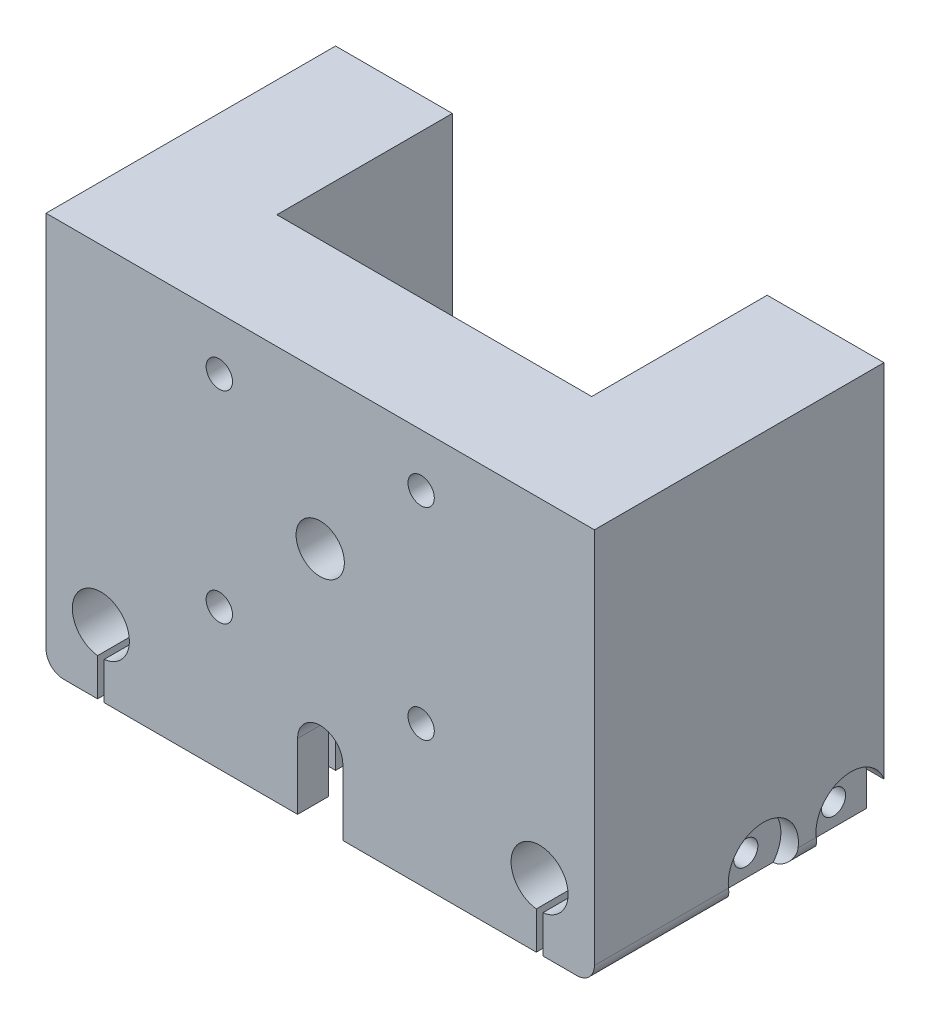
from build123d import *

# Parameters (mm, degrees)
SKETCH1_W           = 62.5
SKETCH1_H           = 45
BOSS_EXTRUDE1_DEPTH = 20
SKETCH2_W           = 37.5
SKETCH2_H           = 45
CUT_EXTRUDE1_DEPTH  = 5
SKETCH3_R           = 11.5
CUT_EXTRUDE2_DEPTH  = 2
SKETCH4_R           = 1.5
CUT_EXTRUDE3_DEPTH  = 15
CIRPATTERN1_COUNT   = 4
SKETCH5_R           = 2.75
CUT_EXTRUDE4_DEPTH  = 58.66769
CUT_EXTRUDE7_START  = -6.5
CUT_EXTRUDE7_DEPTH  = 3
CUT_EXTRUDE8_DEPTH  = 6.5
CUT_EXTRUDE9_DEPTH  = 5.5
SKETCH11_R          = 1.375
CUT_EXTRUDE10_DEPTH = 80.569152
FILLET1_R           = 2
SKETCH12_R          = 3.625
CUT_EXTRUDE12_DEPTH = 3
BOSS_EXTRUDE2_START = 20
BOSS_EXTRUDE2_DEPTH = 20
SKETCH14_R          = 4
CUT_EXTRUDE18_DEPTH = 2
SKETCH15_W          = 62.5
SKETCH15_H          = 45
CUT_EXTRUDE19_DEPTH = 7
SKETCH16_R          = 3.25
CUT_EXTRUDE20_DEPTH = 64.957506
SKETCH17_R          = 1.375
CUT_EXTRUDE21_DEPTH = 79.008013


with BuildPart() as part:
    # Sketch1 → Boss-Extrude1 (new body)
    with BuildSketch(Plane.XY):
        with Locations((0, 22.5)):
            Rectangle(SKETCH1_W, SKETCH1_H)
    extrude(amount=BOSS_EXTRUDE1_DEPTH)

    # Sketch2 → Cut-Extrude1 (cut)
    with BuildSketch(Plane.XY.offset(20)):
        with Locations((0, 22.5)):
            Rectangle(SKETCH2_W, SKETCH2_H)
    extrude(amount=-CUT_EXTRUDE1_DEPTH, mode=Mode.SUBTRACT)

    # Sketch3 → Cut-Extrude2 (cut)
    with BuildSketch(Plane(origin=(0, 0, 0), x_dir=(-1, 0, 0), z_dir=(0, 0, -1))):
        with Locations((0, 27.5)):
            Circle(SKETCH3_R)
    extrude(amount=-CUT_EXTRUDE2_DEPTH, mode=Mode.SUBTRACT)

    # Sketch4 → Cut-Extrude3 (cut)
    with BuildSketch(Plane(origin=(0, 0, 0), x_dir=(-1, 0, 0), z_dir=(0, 0, -1))):
        with Locations((11.5, 39)):
            Circle(SKETCH4_R)
    cut_extrude3 = extrude(amount=-CUT_EXTRUDE3_DEPTH, mode=Mode.SUBTRACT)

    # CirPattern1: Cut-Extrude3 ×4 about axis
    cirpattern1_axis = Axis((0, 27.5, 0), (0, 0, 1))
    for i in range(1, CIRPATTERN1_COUNT):
        add(cut_extrude3.rotate(cirpattern1_axis, i * 360 / CIRPATTERN1_COUNT), mode=Mode.SUBTRACT)

    # Sketch5 → Cut-Extrude4 (cut, through all)
    with BuildSketch(Plane(origin=(0, 0, 2), x_dir=(-1, 0, 0), z_dir=(0, 0, -1))):
        with Locations((0, 27.5)):
            Circle(SKETCH5_R)
    extrude(amount=-CUT_EXTRUDE4_DEPTH, mode=Mode.SUBTRACT)

    # Sketch8 → Cut-Extrude7 (cut)
    with BuildSketch(Plane(origin=(0, 0, 0), x_dir=(-1, 0, 0), z_dir=(0, 0, -1)).offset(CUT_EXTRUDE7_START)):
        with BuildLine():
            Line((7.125, 0), (-7.125, 0))
            Line((-7.125, 0), (-7.125, 11.75))
            ThreePointArc((-7.125, 11.75), (-6.539214, 13.164214), (-5.125, 13.75))
            Line((-5.125, 13.75), (5.125, 13.75))
            ThreePointArc((5.125, 13.75), (6.539214, 13.164214), (7.125, 11.75))
            Line((7.125, 11.75), (7.125, 0))
        make_face()
    extrude(amount=-CUT_EXTRUDE7_DEPTH, mode=Mode.SUBTRACT)

    # Sketch9 → Cut-Extrude8 (cut)
    with BuildSketch(Plane(origin=(0, 0, 0), x_dir=(-1, 0, 0), z_dir=(0, 0, -1))):
        with BuildLine():
            Line((4.75, 7.5), (4.75, 0))
            Line((4.75, 0), (-4.75, 0))
            Line((-4.75, 0), (-4.75, 7.5))
            ThreePointArc((-4.75, 7.5), (0, 12.25), (4.75, 7.5))
        make_face()
    extrude(amount=-CUT_EXTRUDE8_DEPTH, mode=Mode.SUBTRACT)

    # Sketch10 → Cut-Extrude9 (cut)
    with BuildSketch(Plane.XY.offset(15)):
        with BuildLine():
            Line((2.575, 7.5), (2.575, 0))
            Line((2.575, 0), (-2.575, 0))
            Line((-2.575, 0), (-2.575, 7.5))
            ThreePointArc((-2.575, 7.5), (0, 10.075), (2.575, 7.5))
        make_face()
    extrude(amount=-CUT_EXTRUDE9_DEPTH, mode=Mode.SUBTRACT)

    # Sketch11 → Cut-Extrude10 (cut, through all)
    with BuildSketch(Plane(origin=(31.25, 0, 0), x_dir=(0, 0, -1), z_dir=(1, 0, 0))):
        with Locations(Location((-17.5, 2.5, 0), (0, 0, 90))):
            Circle(SKETCH11_R)
    extrude(amount=-CUT_EXTRUDE10_DEPTH, mode=Mode.SUBTRACT)

    # Fillet1
    # the kernel refuses this fillet: 2 mm, written as the material it takes off along each edge
    with BuildSketch(Plane(origin=(31.25, 0, -5), x_dir=(0, 1, 0), z_dir=(0, 0, 1)), Plane(origin=(-31.25, 0, -5), x_dir=(1, 0, 0), z_dir=(0, 0, 1))) as fillet1_piece_1:
        with BuildLine():
            CenterArc((FILLET1_R, FILLET1_R), FILLET1_R, 180, 90)
            Line((0, FILLET1_R), (0, 0))
            Line((0, 0), (FILLET1_R, 0))
        make_face()
    extrude(amount=30, mode=Mode.SUBTRACT)

    # Sketch12 → Cut-Extrude12 (cut)
    with BuildSketch(Plane(origin=(31.25, 0, 0), x_dir=(0, 0, -1), z_dir=(1, 0, 0))):
        with Locations((-17.5, 2.5)):
            Circle(SKETCH12_R)
    cut_extrude12 = extrude(amount=-CUT_EXTRUDE12_DEPTH, mode=Mode.SUBTRACT)

    # Mirror3: Cut-Extrude12 across plane
    add(cut_extrude12.mirror(Plane(origin=(0, 0, 0), x_dir=(0, 0, 1), z_dir=(1, 0, 0))), mode=Mode.SUBTRACT)

    # Sketch13 → Boss-Extrude2 (add)
    with BuildSketch(Plane(origin=(0, 0, 0), x_dir=(-1, 0, 0), z_dir=(0, 0, -1)).offset(BOSS_EXTRUDE2_START)):
        with BuildLine():
            Line((17.93986, 0), (29.25, 0))
            ThreePointArc((29.25, 0), (30.664214, 0.585786), (31.25, 2))
            Line((31.25, 2), (31.25, 45))
            Line((31.25, 45), (17.93986, 45))
            Line((17.93986, 45), (17.93986, 0))
        make_face()
    boss_extrude2 = extrude(amount=-BOSS_EXTRUDE2_DEPTH)

    # Sketch14 → Cut-Extrude18 (cut)
    with BuildSketch(Plane.ZY.offset(31.25)):
        with BuildLine():
            ThreePointArc((-20, 3.891941), (-20.187004, 3.207107), (-20.25, 2.5))
            ThreePointArc((-20.25, 2.5), (-19.588022, 0.296002), (-17.821195, -1.178498))
            ThreePointArc((-17.821195, -1.178498), (-14.259364, -0.969491), (-12.281373, 2))
            Line((-12.281373, 2), (-20, 2))
            Line((-20, 2), (-20, 3.891941))
        make_face()
        with BuildLine():
            ThreePointArc((-12.25, 2.5), (-15.542893, 6.437004), (-20, 3.891941))
            Line((-20, 3.891941), (-20, 2))
            Line((-20, 2), (-12.281373, 2))
            ThreePointArc((-12.281373, 2), (-12.257851, 2.249508), (-12.25, 2.5))
        make_face()
        with BuildLine():
            ThreePointArc((-17.821195, -1.178498), (-19.588022, 0.296002), (-20.25, 2.5))
            Line((-20.25, 2.5), (-20.25, -1.178498))
            Line((-20.25, -1.178498), (-17.821195, -1.178498))
        make_face()
        with Locations((-6.25, 2.5)):
            Circle(SKETCH14_R)
    cut_extrude18 = extrude(amount=-CUT_EXTRUDE18_DEPTH, mode=Mode.SUBTRACT)

    # Sketch15 → Cut-Extrude19 (cut)
    with BuildSketch(Plane.XY.offset(20)):
        with Locations((0, 22.5)):
            Rectangle(SKETCH15_W, SKETCH15_H)
    extrude(amount=-CUT_EXTRUDE19_DEPTH, mode=Mode.SUBTRACT)

    # Sketch16 → Cut-Extrude20 (cut, through all)
    with BuildSketch(Plane.XY.offset(13)):
        with BuildLine():
            Line((-24.625, 0), (-24.625, 4.271707))
            ThreePointArc((-24.625, 4.271707), (-25, 4.25), (-25.375, 4.271707))
            Line((-25.375, 4.271707), (-25.375, 0))
            Line((-25.375, 0), (-24.625, 0))
        make_face()
        with Locations((-25, 7.5)):
            Circle(SKETCH16_R)
    cut_extrude20 = extrude(amount=-CUT_EXTRUDE20_DEPTH, mode=Mode.SUBTRACT)

    # Mirror4: Boss-Extrude2, Cut-Extrude18, Cut-Extrude20 across plane
    add(boss_extrude2.mirror(Plane(origin=(0, 0, 0), x_dir=(0, 0, 1), z_dir=(1, 0, 0))))
    add(cut_extrude18.mirror(Plane(origin=(0, 0, 0), x_dir=(0, 0, 1), z_dir=(1, 0, 0))), mode=Mode.SUBTRACT)
    add(cut_extrude20.mirror(Plane(origin=(0, 0, 0), x_dir=(0, 0, 1), z_dir=(1, 0, 0))), mode=Mode.SUBTRACT)

    # Sketch17 → Cut-Extrude21 (cut, through all)
    with BuildSketch(Plane.ZY.offset(29.25)):
        with Locations(Location((-6.25, 2.5, 0), (0, 0, 180))):
            Circle(SKETCH17_R)
        with Locations(Location((-16.25, 2.5, 0), (0, 0, 180))):
            Circle(SKETCH17_R)
    extrude(amount=-CUT_EXTRUDE21_DEPTH, mode=Mode.SUBTRACT)


solid = part.part
